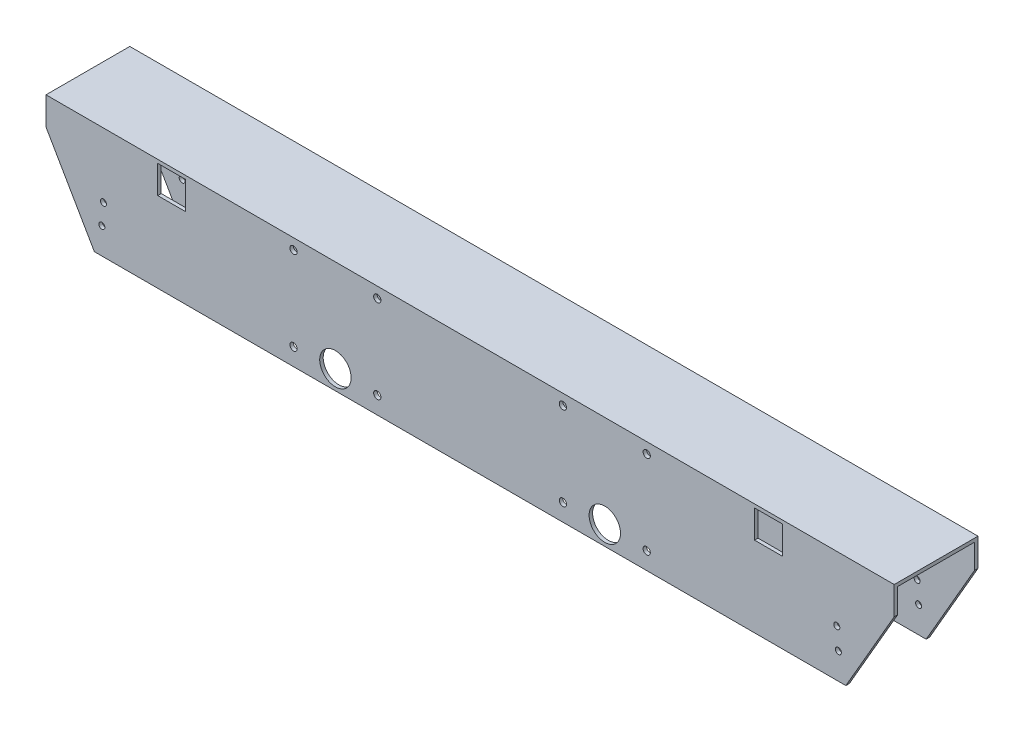
from build123d import *

# Parameters (mm, degrees)
BOSS_EXTRUDE1_DEPTH   = 385.705756272
SKETCH2_R             = 2.749999961
SKETCH2_R_2           = 14.2875
SKETCH2_R_3           = 2.75
CUT_EXTRUDE1_DEPTH    = 141.732
SKETCH14_R            = 3.302
CUT_EXTRUDE12_DEPTH   = 397.429073633
CUT_EXTRUDE13_DEPTH   = 101.6
CUT_EXTRUDE20_REACH   = 398.429
SKETCH25_W            = 25.4
SKETCH25_H            = 25.4
F_6_CLEARANCE_HOLE2_D = 3.7973


with BuildPart() as part:
    # Sketch1 → Boss-Extrude1 (new, symmetric)
    with BuildSketch(Plane(origin=(0, 0, 0), x_dir=(0, 0, -1), z_dir=(1, 0, 0))):
        Polygon((-38.1, 50.8), (38.1, 50.8), (38.1, -50.8), (34.925, -50.8), (34.925, 47.625), (-34.925, 47.625), (-34.925, -50.8), (-38.1, -50.8), align=None)
    extrude(amount=BOSS_EXTRUDE1_DEPTH, both=True)

    # Sketch2 → Cut-Extrude1 (cut)
    with BuildSketch(Plane.XY.offset(38.1)):
        with Locations((-333.475837626, -7.9375)):
            Circle(SKETCH2_R)
        with Locations((122.50039, -33.3375)):
            Circle(SKETCH2_R_2)
        with Locations((333.475837626, -7.9375)):
            Circle(SKETCH2_R)
        with Locations((334.902632555, -26.927596819)):
            Circle(SKETCH2_R_3)
        with Locations((-122.50039, -33.3375)):
            Circle(SKETCH2_R_2)
        with Locations((-334.902632555, -26.927596819)):
            Circle(SKETCH2_R_3)
    extrude(amount=-CUT_EXTRUDE1_DEPTH, mode=Mode.SUBTRACT)

    # Sketch14 → Cut-Extrude12 (cut, through all)
    with BuildSketch(Plane(origin=(0, 0, -38.1), x_dir=(-1, 0, 0), z_dir=(0, 0, -1))):
        with Locations((-160.60039, -35.123476108)):
            Circle(SKETCH14_R)
        with Locations((-160.61182, 41.076523035)):
            Circle(SKETCH14_R)
        with Locations((-84.41182, 41.076523892)):
            Circle(SKETCH14_R)
        with Locations((-84.41182, -35.123476108)):
            Circle(SKETCH14_R)
        with Locations((160.60039, -35.123476108)):
            Circle(SKETCH14_R)
        with Locations((84.41182, -35.123476108)):
            Circle(SKETCH14_R)
        with Locations((84.41182, 41.076523892)):
            Circle(SKETCH14_R)
        with Locations((160.61182, 41.076523035)):
            Circle(SKETCH14_R)
    extrude(amount=-CUT_EXTRUDE12_DEPTH, mode=Mode.SUBTRACT)

    # Sketch16 → Cut-Extrude13 (cut)
    with BuildSketch(Plane.XY.offset(38.1)):
        Polygon((-385.705756272, 25.4), (-341.71166576, -50.8), (-385.705756272, -50.8), align=None)
        Polygon((341.71166576, -50.8), (385.705756272, -50.8), (385.705756272, 25.4), align=None)
    extrude(amount=-CUT_EXTRUDE13_DEPTH, mode=Mode.SUBTRACT)

    # Sketch25 → Cut-Extrude20 (cut, up to next)
    with BuildSketch(Plane.XY.offset(38.1), mode=Mode.PRIVATE) as cut_extrude20_sk1:
        with Locations((271.405756272, 34.925)):
            Rectangle(SKETCH25_W, SKETCH25_H)
    cut_extrude20_tool1 = extrude(cut_extrude20_sk1.sketch, amount=-CUT_EXTRUDE20_REACH, mode=Mode.PRIVATE) & part.part
    # Sketch25 → Cut-Extrude20 (cut, up to next)
    with BuildSketch(Plane.XY.offset(38.1), mode=Mode.PRIVATE) as cut_extrude20_sk2:
        with Locations((-271.405756272, 34.925)):
            Rectangle(SKETCH25_W, SKETCH25_H)
    cut_extrude20_tool2 = extrude(cut_extrude20_sk2.sketch, amount=-CUT_EXTRUDE20_REACH, mode=Mode.PRIVATE) & part.part
    add(cut_extrude20_tool1.solids().sort_by_distance((271.405756, 34.925, 38.1))[0], mode=Mode.SUBTRACT)
    add(cut_extrude20_tool2.solids().sort_by_distance((-271.405756, 34.925, 38.1))[0], mode=Mode.SUBTRACT)

    # #6 Clearance Hole2 (through all)
    with Locations(Plane.XY.offset(-34.925)):
        with Locations((-271.405756272, 34.925), (271.405756272, 34.925)):
            Hole(F_6_CLEARANCE_HOLE2_D / 2)


solid = part.part
